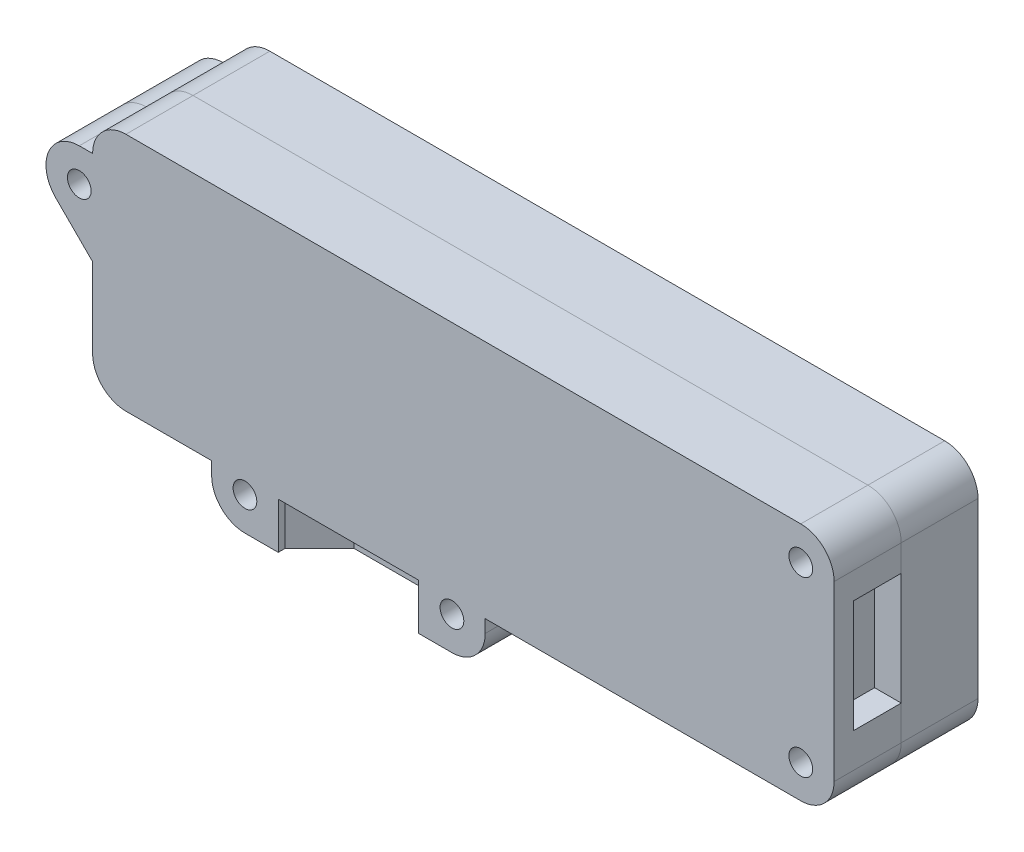
from build123d import *

# Parameters (mm, degrees)
BOSS_EXTRUDE1_START                               = 0.762
BOSS_EXTRUDE1_DEPTH                               = 13.716
SKETCH2_W                                         = 4.549322437
SKETCH2_H                                         = 10.713432518
CUT_EXTRUDE1_DEPTH                                = 2.54
SKETCH3_W                                         = 13.378
SKETCH3_H                                         = 5.778
SKETCH3_W_2                                       = 5.516
SKETCH3_H_2                                       = 3.016
BOSS_EXTRUDE2_DEPTH                               = 4.39457265
BOSS_EXTRUDE3_DEPTH                               = 13.716
CSK_FOR_4_FLAT_HEAD_MACHINE_SCREW_100_D           = 2.9464
CSK_FOR_4_FLAT_HEAD_MACHINE_SCREW_100_DEPTH       = 7.316622713
CSK_FOR_4_FLAT_HEAD_MACHINE_SCREW_100_CSINK_D     = 5.715
CSK_FOR_4_FLAT_HEAD_MACHINE_SCREW_100_CSINK_ANGLE = 100
CSK_FOR_4_FLAT_HEAD_MACHINE_SCREW_100_TIP         = 0.885187864
TAP_DRILL_FOR_4_40_TAP1_D                         = 2.2606
CHAMFER2_SIZE                                     = 3.302


# Read off the part's stored shape, not the designer's step: Split1
with BuildPart() as part:
    # Sketch1 → Boss-Extrude1 (new body)
    with BuildSketch(Plane.XY.offset(BOSS_EXTRUDE1_START)):
        with BuildLine():
            Line((-18.415, 11.43), (45.907212097, 11.43))
            ThreePointArc((45.907212097, 11.43), (48.152276127, 10.50006403), (49.082212097, 8.255))
            Line((49.082212097, 8.255), (49.082212097, -8.255))
            ThreePointArc((49.082212097, -8.255), (48.152276127, -10.50006403), (45.907212097, -11.43))
            Line((45.907212097, -11.43), (-18.415, -11.43))
            ThreePointArc((-18.415, -11.43), (-20.66006403, -10.50006403), (-21.59, -8.255))
            Line((-21.59, -8.255), (-21.59, 8.255))
            ThreePointArc((-21.59, 8.255), (-20.66006403, 10.50006403), (-18.415, 11.43))
        make_face()
    extrude(amount=-BOSS_EXTRUDE1_DEPTH)

    # Sketch2 → Cut-Extrude1 (cut)
    with BuildSketch(Plane(origin=(49.082212097, 0, 0), x_dir=(0, 0, -1), z_dir=(1, 0, 0))):
        with Locations((3.362716069, 0.383061409)):
            Rectangle(SKETCH2_W, SKETCH2_H)
    extrude(amount=-CUT_EXTRUDE1_DEPTH, mode=Mode.SUBTRACT)

    # Sketch3 → Boss-Extrude2 (add)
    with BuildSketch(Plane.XZ.offset(11.43)):
        with Locations((2.794, -6.064)):
            Rectangle(SKETCH3_W, SKETCH3_H)
        with Locations((2.794, -6.064)):
            Rectangle(SKETCH3_W_2, SKETCH3_H_2, mode=Mode.SUBTRACT)
    extrude(amount=BOSS_EXTRUDE2_DEPTH)

    # Sketch6 → Boss-Extrude3 (add, through all)
    with BuildSketch(Plane(origin=(0, 0, -12.954), x_dir=(-1, 0, 0), z_dir=(0, 0, -1))):
        with BuildLine():
            Line((22.86, 8.255), (21.59, 8.255))
            Line((21.59, 8.255), (21.59, 1.905))
            Line((21.59, 1.905), (21.59, -0.680128061))
            Line((21.59, -0.680128061), (25.10506403, 2.83493597))
            ThreePointArc((25.10506403, 2.83493597), (25.793317516, 6.295019898), (22.86, 8.255))
        make_face()
        with BuildLine():
            Line((7.07, -15.82457265), (3.895, -15.82457265))
            Line((3.895, -15.82457265), (3.895, -11.43))
            Line((3.895, -11.43), (10.245, -11.43))
            Line((10.245, -11.43), (10.245, -12.64957265))
            ThreePointArc((10.245, -12.64957265), (9.31506403, -14.89463668), (7.07, -15.82457265))
        make_face()
        with BuildLine():
            Line((-9.483, -11.43), (-9.483, -15.82457265))
            Line((-9.483, -15.82457265), (-12.658, -15.82457265))
            ThreePointArc((-12.658, -15.82457265), (-14.90306403, -14.89463668), (-15.833, -12.64957265))
            Line((-15.833, -12.64957265), (-15.833, -11.43))
            Line((-15.833, -11.43), (-9.483, -11.43))
        make_face()
    extrude(amount=-BOSS_EXTRUDE3_DEPTH)

    # CSK for #4 Flat Head Machine Screw (100)1
    with Locations(Plane(origin=(0, 0, -12.954), x_dir=(-1, 0, 0), z_dir=(0, 0, -1))):
        with Locations((-45.907212097, -8.255), (-45.907212097, 8.255), (7.07, -12.64957265), (22.86, 5.08), (-12.658, -12.64957265)):
            CounterSinkHole(CSK_FOR_4_FLAT_HEAD_MACHINE_SCREW_100_D / 2, CSK_FOR_4_FLAT_HEAD_MACHINE_SCREW_100_CSINK_D / 2, depth=CSK_FOR_4_FLAT_HEAD_MACHINE_SCREW_100_DEPTH, counter_sink_angle=CSK_FOR_4_FLAT_HEAD_MACHINE_SCREW_100_CSINK_ANGLE)
            with Locations((0, 0, -(CSK_FOR_4_FLAT_HEAD_MACHINE_SCREW_100_DEPTH + CSK_FOR_4_FLAT_HEAD_MACHINE_SCREW_100_TIP / 2))):  # 118° drill point
                Cone(0, CSK_FOR_4_FLAT_HEAD_MACHINE_SCREW_100_D / 2, CSK_FOR_4_FLAT_HEAD_MACHINE_SCREW_100_TIP, mode=Mode.SUBTRACT)

    # Tap Drill for #4-40 Tap1 (through all)
    with Locations(Plane(origin=(0, 0, -5.637377287), x_dir=(-1, 0, 0), z_dir=(0, 0, -1))):
        with Locations((-45.907212097, 8.255), (-45.907212097, -8.255), (22.86, 5.08), (7.07, -12.64957265), (-12.658, -12.64957265)):
            Hole(TAP_DRILL_FOR_4_40_TAP1_D / 2)

    # Chamfer2
    chamfer2_edges = [part.edges().sort_by_distance(p)[0] for p in [
        (9.483, -13.627286325, -8.953),
        (9.483, -13.627286325, -3.175),
        (2.794, -11.43, -3.175),
        (-3.895, -13.627286325, -3.175),
        (-3.895, -13.627286325, -8.953),
        (2.794, -11.43, -8.953),
    ]]
    chamfer(chamfer2_edges, length=CHAMFER2_SIZE)


with BuildPart() as body_2:
    # Split1: the piece on the far side of the plane
    add(part.part)
    split(bisect_by=Plane.XY.offset(-5.637377287), keep=Keep.BOTTOM)


with BuildPart() as part_1:
    add(part.part)

    # Split1
    split(bisect_by=Plane.XY.offset(-5.637377287), keep=Keep.TOP)


solid = Compound([body_2.part, part_1.part])
